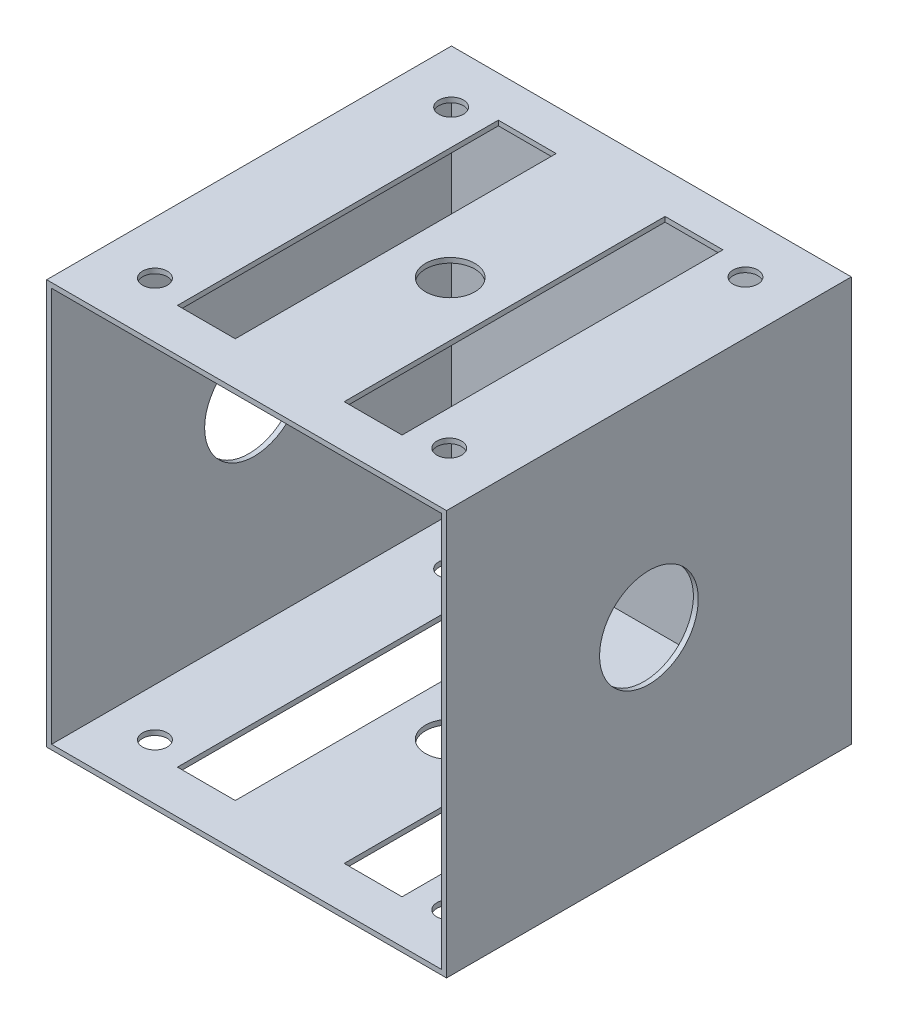
from build123d import *

# Parameters (mm, degrees)
SKETCH1_W               = 205.74
SKETCH1_H               = 208.28
BOSS_EXTRUDE1_DEPTH     = 208.28
SHELL1_T                = -2.54
CUT_EXTRUDE1_DEPTH      = 311.309108632
CUT_EXTRUDE1_DEPTH_BACK = 311.309108632
SKETCH2_R               = 12.7
SKETCH2_R_2             = 6.35
SKETCH4_R               = 2.5
CUT_EXTRUDE2_DEPTH      = 208.28
SKETCH5_W               = 17.056283611
SKETCH5_H               = 152.4
BOSS_EXTRUDE2_DEPTH     = 3.175
CHAMFER1_SIZE           = 6.35
SKETCH6_W               = 29.756283611
SKETCH6_H               = 165.1
CUT_EXTRUDE3_DEPTH      = 3.175
SKETCH7_R               = 25.4
CUT_EXTRUDE4_DEPTH      = 312.810864508
SKETCH8_W               = 29.756283611
SKETCH8_H               = 165.1
CUT_EXTRUDE5_DEPTH      = 315.127382323


with BuildPart() as part:
    # Sketch1 → Boss-Extrude1 (new body)
    with BuildSketch(Plane.XY):
        Rectangle(SKETCH1_W, SKETCH1_H)
    extrude(amount=BOSS_EXTRUDE1_DEPTH)

    # Shell1
    shell1_openings = [part.faces().sort_by_distance(p)[0] for p in [
        (0, 0, 208.28),
    ]]
    offset(amount=SHELL1_T, openings=shell1_openings, kind=Kind.INTERSECTION)

    # Sketch2 → Cut-Extrude1 (cut, two sides: drawn at the far end of the back side and taken through both)
    with BuildSketch(Plane(origin=(0, -101.6, 0), x_dir=(1, 0, 0), z_dir=(0, 1, 0)).offset(-CUT_EXTRUDE1_DEPTH_BACK)):
        with Locations(Location((0, -103.531491014, 0), (0, 0, 180))):
            Circle(SKETCH2_R)
        with Locations(Location((-75.713137358, -27.331491014, 0), (0, 0, 180))):
            Circle(SKETCH2_R_2)
        with Locations(Location((75.713137358, -27.331491014, 0), (0, 0, 180))):
            Circle(SKETCH2_R_2)
        with Locations(Location((75.713137358, -179.731491014, 0), (0, 0, 180))):
            Circle(SKETCH2_R_2)
        with Locations(Location((-75.713137358, -179.731491014, 0), (0, 0, 180))):
            Circle(SKETCH2_R_2)
    extrude(amount=CUT_EXTRUDE1_DEPTH + CUT_EXTRUDE1_DEPTH_BACK, mode=Mode.SUBTRACT)

    # Sketch4 → Cut-Extrude2 (cut)
    with BuildSketch(Plane.XY.offset(2.54)):
        Circle(SKETCH4_R)
        with Locations((33.02, 0)):
            Circle(SKETCH4_R)
        with Locations((-33.02, 0)):
            Circle(SKETCH4_R)
    extrude(amount=-CUT_EXTRUDE2_DEPTH, mode=Mode.SUBTRACT)

    # Sketch5 → Boss-Extrude2 (add)
    with BuildSketch(Plane(origin=(0, 104.14, 0), x_dir=(1, 0, 0), z_dir=(0, 1, 0))):
        with Locations((-42.900680362, -103.531491014)):
            Rectangle(SKETCH5_W, SKETCH5_H)
        with Locations((42.900680362, -103.531491014)):
            Rectangle(SKETCH5_W, SKETCH5_H)
    extrude(amount=BOSS_EXTRUDE2_DEPTH)

    # Chamfer1
    # the kernel refuses this chamfer: 6.35 mm, written as the material it adds along each edge
    with BuildSketch(Plane(origin=(51.428822168, 104.14, 179.731491014), x_dir=(0, -0.027495876610585696, 0.9996219169112966), z_dir=(-1, 0, 0))) as chamfer1_piece_1_section:
        Polygon((CHAMFER1_SIZE * 0.999621916911, CHAMFER1_SIZE * 0.0274958766106), (-CHAMFER1_SIZE * 0.0274958766106, CHAMFER1_SIZE * 0.999621916911), (0, 0), align=None)
    chamfer1_piece_1 = extrude(amount=17.05628361, mode=Mode.PRIVATE)
    chamfer1_piece_1 = split(chamfer1_piece_1, bisect_by=Plane(origin=(42.900680363, 107.315, 182.229587898), z_dir=(0, -1, 0)), keep=Keep.TOP, mode=Mode.PRIVATE)
    add(chamfer1_piece_1)
    with BuildSketch(Plane(origin=(51.428822168, 104.14, 27.331491014), x_dir=(0.9996219169112968, -0.027495876610583406, 0), z_dir=(0, 0, 1))) as chamfer1_piece_2_section:
        Polygon((CHAMFER1_SIZE * 0.999621916911, CHAMFER1_SIZE * 0.0274958766106), (-CHAMFER1_SIZE * 0.0274958766106, CHAMFER1_SIZE * 0.999621916911), (0, 0), align=None)
    chamfer1_piece_2 = extrude(amount=152.4, mode=Mode.PRIVATE)
    chamfer1_piece_2 = split(chamfer1_piece_2, bisect_by=Plane(origin=(53.926919052, 107.315, 103.531491014), z_dir=(0, -1, 0)), keep=Keep.TOP, mode=Mode.PRIVATE)
    add(chamfer1_piece_2)
    with BuildSketch(Plane(origin=(34.372538557, 104.14, 27.331491014), x_dir=(0, -0.027495876610585654, -0.9996219169112968), z_dir=(1, 0, 0))) as chamfer1_piece_3_section:
        Polygon((CHAMFER1_SIZE * 0.999621916911, CHAMFER1_SIZE * 0.0274958766106), (-CHAMFER1_SIZE * 0.0274958766106, CHAMFER1_SIZE * 0.999621916911), (0, 0), align=None)
    chamfer1_piece_3 = extrude(amount=17.05628361, mode=Mode.PRIVATE)
    chamfer1_piece_3 = split(chamfer1_piece_3, bisect_by=Plane(origin=(42.900680363, 107.315, 24.83339413), z_dir=(0, -1, 0)), keep=Keep.TOP, mode=Mode.PRIVATE)
    add(chamfer1_piece_3)
    with BuildSketch(Plane(origin=(34.372538557, 104.14, 179.731491014), x_dir=(-0.9996219169112968, -0.027495876610585685, 0), z_dir=(0, 0, -1))) as chamfer1_piece_4_section:
        Polygon((CHAMFER1_SIZE * 0.999621916911, CHAMFER1_SIZE * 0.0274958766106), (-CHAMFER1_SIZE * 0.0274958766106, CHAMFER1_SIZE * 0.999621916911), (0, 0), align=None)
    chamfer1_piece_4 = extrude(amount=152.4, mode=Mode.PRIVATE)
    chamfer1_piece_4 = split(chamfer1_piece_4, bisect_by=Plane(origin=(31.874441673, 107.315, 103.531491014), z_dir=(0, -1, 0)), keep=Keep.TOP, mode=Mode.PRIVATE)
    add(chamfer1_piece_4)
    with BuildSketch(Plane(origin=(-51.428822168, 104.14, 27.331491014), x_dir=(0, -0.027495876610585654, -0.9996219169112968), z_dir=(1, 0, 0))) as chamfer1_piece_5_section:
        Polygon((CHAMFER1_SIZE * 0.999621916911, CHAMFER1_SIZE * 0.0274958766106), (-CHAMFER1_SIZE * 0.0274958766106, CHAMFER1_SIZE * 0.999621916911), (0, 0), align=None)
    chamfer1_piece_5 = extrude(amount=17.05628361, mode=Mode.PRIVATE)
    chamfer1_piece_5 = split(chamfer1_piece_5, bisect_by=Plane(origin=(-42.900680363, 107.315, 24.83339413), z_dir=(0, -1, 0)), keep=Keep.TOP, mode=Mode.PRIVATE)
    add(chamfer1_piece_5)
    with BuildSketch(Plane(origin=(-51.428822168, 104.14, 179.731491014), x_dir=(-0.9996219169112966, -0.027495876610587812, 0), z_dir=(0, 0, -1))) as chamfer1_piece_6_section:
        Polygon((CHAMFER1_SIZE * 0.999621916911, CHAMFER1_SIZE * 0.0274958766106), (-CHAMFER1_SIZE * 0.0274958766106, CHAMFER1_SIZE * 0.999621916911), (0, 0), align=None)
    chamfer1_piece_6 = extrude(amount=152.4, mode=Mode.PRIVATE)
    chamfer1_piece_6 = split(chamfer1_piece_6, bisect_by=Plane(origin=(-53.926919052, 107.315, 103.531491014), z_dir=(0, -1, 0)), keep=Keep.TOP, mode=Mode.PRIVATE)
    add(chamfer1_piece_6)
    with BuildSketch(Plane(origin=(-34.372538557, 104.14, 179.731491014), x_dir=(0, -0.027495876610585696, 0.9996219169112966), z_dir=(-1, 0, 0))) as chamfer1_piece_7_section:
        Polygon((CHAMFER1_SIZE * 0.999621916911, CHAMFER1_SIZE * 0.0274958766106), (-CHAMFER1_SIZE * 0.0274958766106, CHAMFER1_SIZE * 0.999621916911), (0, 0), align=None)
    chamfer1_piece_7 = extrude(amount=17.05628361, mode=Mode.PRIVATE)
    chamfer1_piece_7 = split(chamfer1_piece_7, bisect_by=Plane(origin=(-42.900680363, 107.315, 182.229587898), z_dir=(0, -1, 0)), keep=Keep.TOP, mode=Mode.PRIVATE)
    add(chamfer1_piece_7)
    with BuildSketch(Plane(origin=(-34.372538557, 104.14, 27.331491014), x_dir=(0.9996219169112968, -0.027495876610585685, 0), z_dir=(0, 0, 1))) as chamfer1_piece_8_section:
        Polygon((CHAMFER1_SIZE * 0.999621916911, CHAMFER1_SIZE * 0.0274958766106), (-CHAMFER1_SIZE * 0.0274958766106, CHAMFER1_SIZE * 0.999621916911), (0, 0), align=None)
    chamfer1_piece_8 = extrude(amount=152.4, mode=Mode.PRIVATE)
    chamfer1_piece_8 = split(chamfer1_piece_8, bisect_by=Plane(origin=(-31.874441673, 107.315, 103.531491014), z_dir=(0, -1, 0)), keep=Keep.TOP, mode=Mode.PRIVATE)
    add(chamfer1_piece_8)
    with BuildSketch(Plane(origin=(67.759009141, 104.14, 179.731491014), x_dir=(0, -0.027495876610585696, 0.9996219169112966), z_dir=(-1, 0, 0))) as chamfer1_piece_9a_section:
        Polygon((CHAMFER1_SIZE * 0.999621916911, CHAMFER1_SIZE * 0.0274958766106), (-CHAMFER1_SIZE * 0.0274958766106, CHAMFER1_SIZE * 0.999621916911), (0, 0), align=None)
    chamfer1_piece_9a = extrude(amount=33.386470584, mode=Mode.PRIVATE)
    chamfer1_piece_9a = split(chamfer1_piece_9a, bisect_by=Plane(origin=(51.428822168, 105.46228774, 182.229587898), z_dir=(1, 0, 0)), keep=Keep.TOP, mode=Mode.PRIVATE)
    chamfer1_piece_9a = split(chamfer1_piece_9a, bisect_by=Plane(origin=(59.593915654, 107.315, 182.229587898), z_dir=(0, -1, 0)), keep=Keep.TOP, mode=Mode.PRIVATE)
    with BuildSketch(Plane(origin=(51.428822168, 104.14, 27.331491014), x_dir=(0.9996219169112968, -0.027495876610583406, 0), z_dir=(0, 0, 1))) as chamfer1_piece_9b_section:
        Polygon((CHAMFER1_SIZE * 0.999621916911, CHAMFER1_SIZE * 0.0274958766106), (-CHAMFER1_SIZE * 0.0274958766106, CHAMFER1_SIZE * 0.999621916911), (0, 0), align=None)
    chamfer1_piece_9b = extrude(amount=168.730186974, mode=Mode.PRIVATE)
    chamfer1_piece_9b = split(chamfer1_piece_9b, bisect_by=Plane(origin=(53.926919052, 105.46228774, 179.731491014), z_dir=(0, 0, 1)), keep=Keep.TOP, mode=Mode.PRIVATE)
    chamfer1_piece_9b = split(chamfer1_piece_9b, bisect_by=Plane(origin=(53.926919052, 107.315, 187.896584501), z_dir=(0, -1, 0)), keep=Keep.TOP, mode=Mode.PRIVATE)
    chamfer1_piece_9 = chamfer1_piece_9a & chamfer1_piece_9b
    add(chamfer1_piece_9)
    with BuildSketch(Plane(origin=(34.372538557, 104.14, 196.061677987), x_dir=(-0.9996219169112968, -0.027495876610585685, 0), z_dir=(0, 0, -1))) as chamfer1_piece_10a_section:
        Polygon((CHAMFER1_SIZE * 0.999621916911, CHAMFER1_SIZE * 0.0274958766106), (-CHAMFER1_SIZE * 0.0274958766106, CHAMFER1_SIZE * 0.999621916911), (0, 0), align=None)
    chamfer1_piece_10a = extrude(amount=168.730186974, mode=Mode.PRIVATE)
    chamfer1_piece_10a = split(chamfer1_piece_10a, bisect_by=Plane(origin=(31.874441673, 105.46228774, 179.731491014), z_dir=(0, 0, 1)), keep=Keep.TOP, mode=Mode.PRIVATE)
    chamfer1_piece_10a = split(chamfer1_piece_10a, bisect_by=Plane(origin=(31.874441673, 107.315, 187.896584501), z_dir=(0, -1, 0)), keep=Keep.TOP, mode=Mode.PRIVATE)
    with BuildSketch(Plane(origin=(51.428822168, 104.14, 179.731491014), x_dir=(0, -0.027495876610585696, 0.9996219169112966), z_dir=(-1, 0, 0))) as chamfer1_piece_10b_section:
        Polygon((CHAMFER1_SIZE * 0.999621916911, CHAMFER1_SIZE * 0.0274958766106), (-CHAMFER1_SIZE * 0.0274958766106, CHAMFER1_SIZE * 0.999621916911), (0, 0), align=None)
    chamfer1_piece_10b = extrude(amount=33.386470584, mode=Mode.PRIVATE)
    chamfer1_piece_10b = split(chamfer1_piece_10b, bisect_by=Plane(origin=(34.372538557, 105.46228774, 182.229587898), z_dir=(-1, 0, 0)), keep=Keep.TOP, mode=Mode.PRIVATE)
    chamfer1_piece_10b = split(chamfer1_piece_10b, bisect_by=Plane(origin=(26.207445071, 107.315, 182.229587898), z_dir=(0, -1, 0)), keep=Keep.TOP, mode=Mode.PRIVATE)
    chamfer1_piece_10 = chamfer1_piece_10a & chamfer1_piece_10b
    add(chamfer1_piece_10)
    with BuildSketch(Plane(origin=(51.428822168, 104.14, 11.00130404), x_dir=(0.9996219169112968, -0.027495876610583492, 0), z_dir=(0, 0, 1))) as chamfer1_piece_11a_section:
        Polygon((CHAMFER1_SIZE * 0.999621916911, CHAMFER1_SIZE * 0.0274958766106), (-CHAMFER1_SIZE * 0.0274958766106, CHAMFER1_SIZE * 0.999621916911), (0, 0), align=None)
    chamfer1_piece_11a = extrude(amount=168.730186974, mode=Mode.PRIVATE)
    chamfer1_piece_11a = split(chamfer1_piece_11a, bisect_by=Plane(origin=(53.926919052, 105.46228774, 27.331491014), z_dir=(0, 0, -1)), keep=Keep.TOP, mode=Mode.PRIVATE)
    chamfer1_piece_11a = split(chamfer1_piece_11a, bisect_by=Plane(origin=(53.926919052, 107.315, 19.166397527), z_dir=(0, -1, 0)), keep=Keep.TOP, mode=Mode.PRIVATE)
    with BuildSketch(Plane(origin=(34.372538557, 104.14, 27.331491014), x_dir=(0, -0.027495876610585654, -0.9996219169112968), z_dir=(1, 0, 0))) as chamfer1_piece_11b_section:
        Polygon((CHAMFER1_SIZE * 0.999621916911, CHAMFER1_SIZE * 0.0274958766106), (-CHAMFER1_SIZE * 0.0274958766106, CHAMFER1_SIZE * 0.999621916911), (0, 0), align=None)
    chamfer1_piece_11b = extrude(amount=33.386470584, mode=Mode.PRIVATE)
    chamfer1_piece_11b = split(chamfer1_piece_11b, bisect_by=Plane(origin=(51.428822168, 105.46228774, 24.83339413), z_dir=(1, 0, 0)), keep=Keep.TOP, mode=Mode.PRIVATE)
    chamfer1_piece_11b = split(chamfer1_piece_11b, bisect_by=Plane(origin=(59.593915654, 107.315, 24.83339413), z_dir=(0, -1, 0)), keep=Keep.TOP, mode=Mode.PRIVATE)
    chamfer1_piece_11 = chamfer1_piece_11a & chamfer1_piece_11b
    add(chamfer1_piece_11)
    with BuildSketch(Plane(origin=(34.372538557, 104.14, 179.731491014), x_dir=(-0.9996219169112968, -0.027495876610585685, 0), z_dir=(0, 0, -1))) as chamfer1_piece_12a_section:
        Polygon((CHAMFER1_SIZE * 0.999621916911, CHAMFER1_SIZE * 0.0274958766106), (-CHAMFER1_SIZE * 0.0274958766106, CHAMFER1_SIZE * 0.999621916911), (0, 0), align=None)
    chamfer1_piece_12a = extrude(amount=168.730186974, mode=Mode.PRIVATE)
    chamfer1_piece_12a = split(chamfer1_piece_12a, bisect_by=Plane(origin=(31.874441673, 105.46228774, 27.331491014), z_dir=(0, 0, -1)), keep=Keep.TOP, mode=Mode.PRIVATE)
    chamfer1_piece_12a = split(chamfer1_piece_12a, bisect_by=Plane(origin=(31.874441673, 107.315, 19.166397527), z_dir=(0, -1, 0)), keep=Keep.TOP, mode=Mode.PRIVATE)
    with BuildSketch(Plane(origin=(18.042351584, 104.14, 27.331491014), x_dir=(0, -0.027495876610585654, -0.9996219169112968), z_dir=(1, 0, 0))) as chamfer1_piece_12b_section:
        Polygon((CHAMFER1_SIZE * 0.999621916911, CHAMFER1_SIZE * 0.0274958766106), (-CHAMFER1_SIZE * 0.0274958766106, CHAMFER1_SIZE * 0.999621916911), (0, 0), align=None)
    chamfer1_piece_12b = extrude(amount=33.386470584, mode=Mode.PRIVATE)
    chamfer1_piece_12b = split(chamfer1_piece_12b, bisect_by=Plane(origin=(34.372538557, 105.46228774, 24.83339413), z_dir=(-1, 0, 0)), keep=Keep.TOP, mode=Mode.PRIVATE)
    chamfer1_piece_12b = split(chamfer1_piece_12b, bisect_by=Plane(origin=(26.207445071, 107.315, 24.83339413), z_dir=(0, -1, 0)), keep=Keep.TOP, mode=Mode.PRIVATE)
    chamfer1_piece_12 = chamfer1_piece_12a & chamfer1_piece_12b
    add(chamfer1_piece_12)
    with BuildSketch(Plane(origin=(-67.759009141, 104.14, 27.331491014), x_dir=(0, -0.027495876610585654, -0.9996219169112968), z_dir=(1, 0, 0))) as chamfer1_piece_13a_section:
        Polygon((CHAMFER1_SIZE * 0.999621916911, CHAMFER1_SIZE * 0.0274958766106), (-CHAMFER1_SIZE * 0.0274958766106, CHAMFER1_SIZE * 0.999621916911), (0, 0), align=None)
    chamfer1_piece_13a = extrude(amount=33.386470584, mode=Mode.PRIVATE)
    chamfer1_piece_13a = split(chamfer1_piece_13a, bisect_by=Plane(origin=(-51.428822168, 105.46228774, 24.83339413), z_dir=(-1, 0, 0)), keep=Keep.TOP, mode=Mode.PRIVATE)
    chamfer1_piece_13a = split(chamfer1_piece_13a, bisect_by=Plane(origin=(-59.593915654, 107.315, 24.83339413), z_dir=(0, -1, 0)), keep=Keep.TOP, mode=Mode.PRIVATE)
    with BuildSketch(Plane(origin=(-51.428822168, 104.14, 179.731491014), x_dir=(-0.9996219169112966, -0.027495876610587812, 0), z_dir=(0, 0, -1))) as chamfer1_piece_13b_section:
        Polygon((CHAMFER1_SIZE * 0.999621916911, CHAMFER1_SIZE * 0.0274958766106), (-CHAMFER1_SIZE * 0.0274958766106, CHAMFER1_SIZE * 0.999621916911), (0, 0), align=None)
    chamfer1_piece_13b = extrude(amount=168.730186974, mode=Mode.PRIVATE)
    chamfer1_piece_13b = split(chamfer1_piece_13b, bisect_by=Plane(origin=(-53.926919052, 105.46228774, 27.331491014), z_dir=(0, 0, -1)), keep=Keep.TOP, mode=Mode.PRIVATE)
    chamfer1_piece_13b = split(chamfer1_piece_13b, bisect_by=Plane(origin=(-53.926919052, 107.315, 19.166397527), z_dir=(0, -1, 0)), keep=Keep.TOP, mode=Mode.PRIVATE)
    chamfer1_piece_13 = chamfer1_piece_13a & chamfer1_piece_13b
    add(chamfer1_piece_13)
    with BuildSketch(Plane(origin=(-34.372538557, 104.14, 11.00130404), x_dir=(0.9996219169112968, -0.027495876610585685, 0), z_dir=(0, 0, 1))) as chamfer1_piece_14a_section:
        Polygon((CHAMFER1_SIZE * 0.999621916911, CHAMFER1_SIZE * 0.0274958766106), (-CHAMFER1_SIZE * 0.0274958766106, CHAMFER1_SIZE * 0.999621916911), (0, 0), align=None)
    chamfer1_piece_14a = extrude(amount=168.730186974, mode=Mode.PRIVATE)
    chamfer1_piece_14a = split(chamfer1_piece_14a, bisect_by=Plane(origin=(-31.874441673, 105.46228774, 27.331491014), z_dir=(0, 0, -1)), keep=Keep.TOP, mode=Mode.PRIVATE)
    chamfer1_piece_14a = split(chamfer1_piece_14a, bisect_by=Plane(origin=(-31.874441673, 107.315, 19.166397527), z_dir=(0, -1, 0)), keep=Keep.TOP, mode=Mode.PRIVATE)
    with BuildSketch(Plane(origin=(-51.428822168, 104.14, 27.331491014), x_dir=(0, -0.027495876610585654, -0.9996219169112968), z_dir=(1, 0, 0))) as chamfer1_piece_14b_section:
        Polygon((CHAMFER1_SIZE * 0.999621916911, CHAMFER1_SIZE * 0.0274958766106), (-CHAMFER1_SIZE * 0.0274958766106, CHAMFER1_SIZE * 0.999621916911), (0, 0), align=None)
    chamfer1_piece_14b = extrude(amount=33.386470584, mode=Mode.PRIVATE)
    chamfer1_piece_14b = split(chamfer1_piece_14b, bisect_by=Plane(origin=(-34.372538557, 105.46228774, 24.83339413), z_dir=(1, 0, 0)), keep=Keep.TOP, mode=Mode.PRIVATE)
    chamfer1_piece_14b = split(chamfer1_piece_14b, bisect_by=Plane(origin=(-26.207445071, 107.315, 24.83339413), z_dir=(0, -1, 0)), keep=Keep.TOP, mode=Mode.PRIVATE)
    chamfer1_piece_14 = chamfer1_piece_14a & chamfer1_piece_14b
    add(chamfer1_piece_14)
    with BuildSketch(Plane(origin=(-51.428822168, 104.14, 196.061677987), x_dir=(-0.9996219169112966, -0.027495876610587812, 0), z_dir=(0, 0, -1))) as chamfer1_piece_15a_section:
        Polygon((CHAMFER1_SIZE * 0.999621916911, CHAMFER1_SIZE * 0.0274958766106), (-CHAMFER1_SIZE * 0.0274958766106, CHAMFER1_SIZE * 0.999621916911), (0, 0), align=None)
    chamfer1_piece_15a = extrude(amount=168.730186974, mode=Mode.PRIVATE)
    chamfer1_piece_15a = split(chamfer1_piece_15a, bisect_by=Plane(origin=(-53.926919052, 105.46228774, 179.731491014), z_dir=(0, 0, 1)), keep=Keep.TOP, mode=Mode.PRIVATE)
    chamfer1_piece_15a = split(chamfer1_piece_15a, bisect_by=Plane(origin=(-53.926919052, 107.315, 187.896584501), z_dir=(0, -1, 0)), keep=Keep.TOP, mode=Mode.PRIVATE)
    with BuildSketch(Plane(origin=(-34.372538557, 104.14, 179.731491014), x_dir=(0, -0.027495876610585696, 0.9996219169112966), z_dir=(-1, 0, 0))) as chamfer1_piece_15b_section:
        Polygon((CHAMFER1_SIZE * 0.999621916911, CHAMFER1_SIZE * 0.0274958766106), (-CHAMFER1_SIZE * 0.0274958766106, CHAMFER1_SIZE * 0.999621916911), (0, 0), align=None)
    chamfer1_piece_15b = extrude(amount=33.386470584, mode=Mode.PRIVATE)
    chamfer1_piece_15b = split(chamfer1_piece_15b, bisect_by=Plane(origin=(-51.428822168, 105.46228774, 182.229587898), z_dir=(-1, 0, 0)), keep=Keep.TOP, mode=Mode.PRIVATE)
    chamfer1_piece_15b = split(chamfer1_piece_15b, bisect_by=Plane(origin=(-59.593915654, 107.315, 182.229587898), z_dir=(0, -1, 0)), keep=Keep.TOP, mode=Mode.PRIVATE)
    chamfer1_piece_15 = chamfer1_piece_15a & chamfer1_piece_15b
    add(chamfer1_piece_15)
    with BuildSketch(Plane(origin=(-34.372538557, 104.14, 27.331491014), x_dir=(0.9996219169112968, -0.027495876610585685, 0), z_dir=(0, 0, 1))) as chamfer1_piece_16a_section:
        Polygon((CHAMFER1_SIZE * 0.999621916911, CHAMFER1_SIZE * 0.0274958766106), (-CHAMFER1_SIZE * 0.0274958766106, CHAMFER1_SIZE * 0.999621916911), (0, 0), align=None)
    chamfer1_piece_16a = extrude(amount=168.730186974, mode=Mode.PRIVATE)
    chamfer1_piece_16a = split(chamfer1_piece_16a, bisect_by=Plane(origin=(-31.874441673, 105.46228774, 179.731491014), z_dir=(0, 0, 1)), keep=Keep.TOP, mode=Mode.PRIVATE)
    chamfer1_piece_16a = split(chamfer1_piece_16a, bisect_by=Plane(origin=(-31.874441673, 107.315, 187.896584501), z_dir=(0, -1, 0)), keep=Keep.TOP, mode=Mode.PRIVATE)
    with BuildSketch(Plane(origin=(-18.042351584, 104.14, 179.731491014), x_dir=(0, -0.027495876610585696, 0.9996219169112966), z_dir=(-1, 0, 0))) as chamfer1_piece_16b_section:
        Polygon((CHAMFER1_SIZE * 0.999621916911, CHAMFER1_SIZE * 0.0274958766106), (-CHAMFER1_SIZE * 0.0274958766106, CHAMFER1_SIZE * 0.999621916911), (0, 0), align=None)
    chamfer1_piece_16b = extrude(amount=33.386470584, mode=Mode.PRIVATE)
    chamfer1_piece_16b = split(chamfer1_piece_16b, bisect_by=Plane(origin=(-34.372538557, 105.46228774, 182.229587898), z_dir=(1, 0, 0)), keep=Keep.TOP, mode=Mode.PRIVATE)
    chamfer1_piece_16b = split(chamfer1_piece_16b, bisect_by=Plane(origin=(-26.207445071, 107.315, 182.229587898), z_dir=(0, -1, 0)), keep=Keep.TOP, mode=Mode.PRIVATE)
    chamfer1_piece_16 = chamfer1_piece_16a & chamfer1_piece_16b
    add(chamfer1_piece_16)

    # Sketch6 → Cut-Extrude3 (cut)
    with BuildSketch(Plane.XZ.offset(104.14)):
        with Locations((42.900680363, 103.531491014)):
            Rectangle(SKETCH6_W, SKETCH6_H)
        with Locations((-42.900680363, 103.531491014)):
            Rectangle(SKETCH6_W, SKETCH6_H)
    extrude(amount=-CUT_EXTRUDE3_DEPTH, mode=Mode.SUBTRACT)

    # Sketch7 → Cut-Extrude4 (cut, through all)
    with BuildSketch(Plane.ZY.offset(102.87)):
        with Locations((104.14, 0)):
            Circle(SKETCH7_R)
    extrude(amount=-CUT_EXTRUDE4_DEPTH, mode=Mode.SUBTRACT)

    # Sketch8 → Cut-Extrude5 (cut, through all)
    with BuildSketch(Plane(origin=(0, 107.315, 0), x_dir=(1, 0, 0), z_dir=(0, 1, 0))):
        with Locations((42.900680363, -103.531491014)):
            Rectangle(SKETCH8_W, SKETCH8_H)
        with Locations((-42.900680363, -103.531491014)):
            Rectangle(SKETCH8_W, SKETCH8_H)
    extrude(amount=-CUT_EXTRUDE5_DEPTH, mode=Mode.SUBTRACT)


solid = part.part
